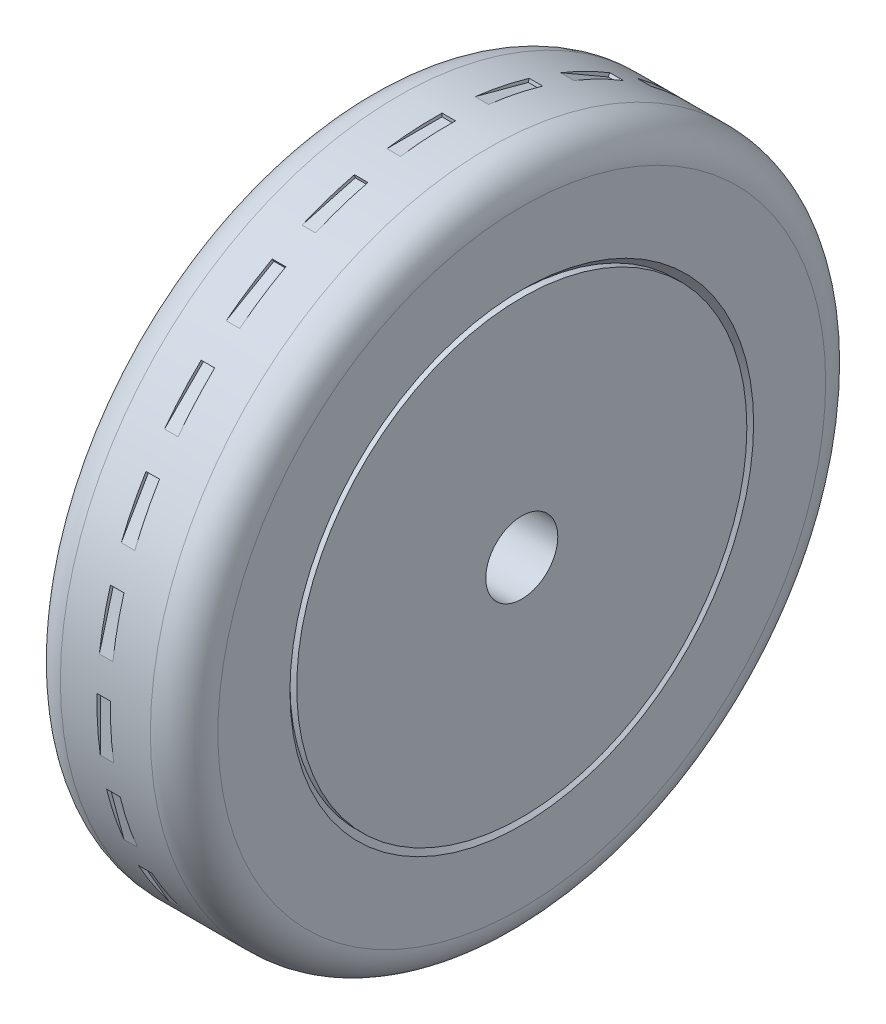
from build123d import *

# Parameters (mm, degrees)
CHAMFER1_SIZE       = 1.5
SKETCH3_W           = 3
SKETCH3_H           = 20
CUT_EXTRUDE3_DEPTH  = 0.75
CIRPATTERN2_COUNT   = 24
SKETCH4_R           = 50
SKETCH4_R_2         = 8
BOSS_EXTRUDE1_DEPTH = 34


with BuildPart() as part:
    # Sketch1 → Revolve1 (revolve)
    with BuildSketch(Plane.XY, mode=Mode.PRIVATE) as revolve1_sk:
        with BuildLine():
            Line((-17.5, 50), (-17.5, 67.5))
            ThreePointArc((-17.5, 67.5), (-15.303300859, 72.803300859), (-10, 75))
            Line((-10, 75), (10, 75))
            ThreePointArc((10, 75), (15.303300859, 72.803300859), (17.5, 67.5))
            Line((17.5, 67.5), (17.5, 50))
            Line((17.5, 50), (14.5, 50))
            Line((14.5, 50), (14.5, 67.5))
            ThreePointArc((14.5, 67.5), (13.181980515, 70.681980515), (10, 72))
            Line((10, 72), (-10, 72))
            ThreePointArc((-10, 72), (-13.181980515, 70.681980515), (-14.5, 67.5))
            Line((-14.5, 67.5), (-14.5, 50))
            Line((-14.5, 50), (-17.5, 50))
        make_face()
    revolve(revolve1_sk.sketch.rotate(Axis((0, 0, 0), (-1, 0, 0)), 90), axis=Axis((0, 0, 0), (-1, 0, 0)))

    # Chamfer1
    chamfer1_edges = [part.edges().sort_by_distance(p)[0] for p in [
        (14.5, 0, 50),
        (17.5, 0, 50),
        (-17.5, 0, 50),
        (-14.5, 0, 50),
    ]]
    chamfer(chamfer1_edges, length=CHAMFER1_SIZE - 0.0001)  # a hair under: the kernel refuses the full size

    # Sketch3 → Cut-Extrude3 (cut, symmetric)
    with BuildSketch(Plane(origin=(0, 75, 0), x_dir=(1, 0, 0), z_dir=(0, 1, 0))):
        with Locations((-0.373210741, -8.336930551)):
            Rectangle(SKETCH3_W, SKETCH3_H)
    cut_extrude3 = extrude(amount=CUT_EXTRUDE3_DEPTH, both=True, mode=Mode.SUBTRACT)

    # CirPattern2: Cut-Extrude3 ×24 about axis
    cirpattern2_axis = Axis((0, 0, 0), (1, 0, 0))
    for i in range(1, CIRPATTERN2_COUNT):
        add(cut_extrude3.rotate(cirpattern2_axis, i * 360 / CIRPATTERN2_COUNT), mode=Mode.SUBTRACT)


with BuildPart() as body_2:
    # Sketch4 → Boss-Extrude1 (new body)
    with BuildSketch(Plane(origin=(17.5, 0, 0), x_dir=(0, 0, -1), z_dir=(1, 0, 0))):
        Circle(SKETCH4_R)
        Circle(SKETCH4_R_2, mode=Mode.SUBTRACT)
    extrude(amount=-BOSS_EXTRUDE1_DEPTH)


solid = Compound([part.part, body_2.part])
